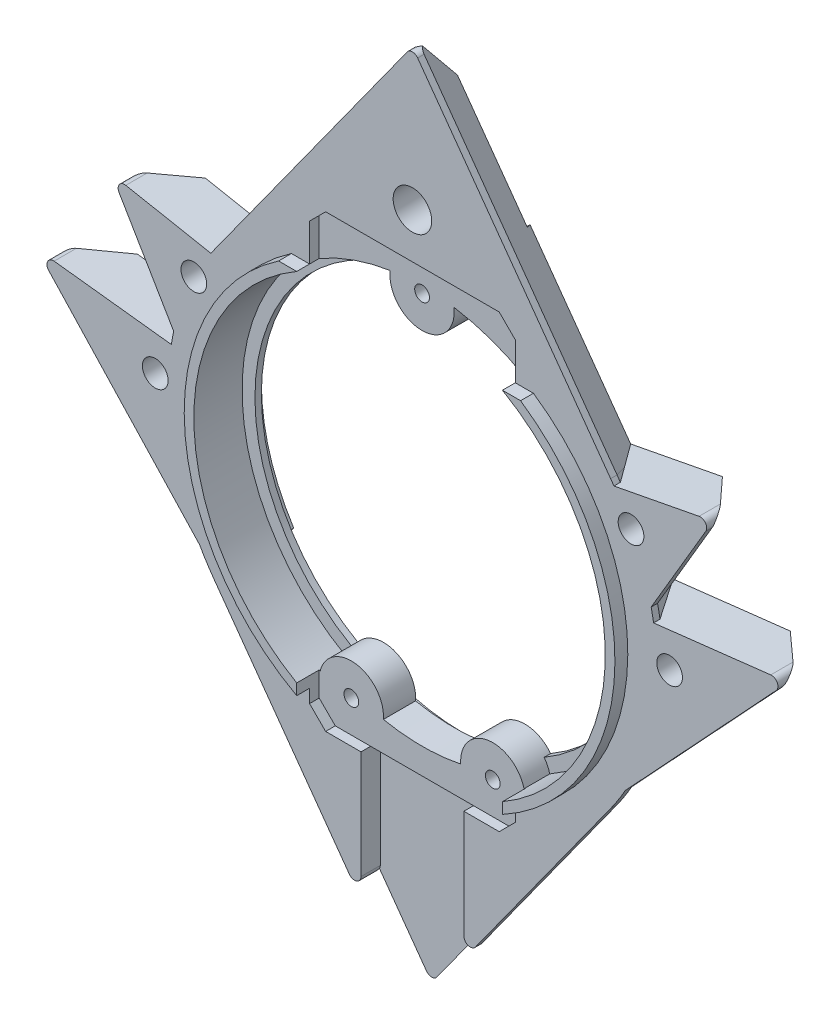
from build123d import *

# Parameters (mm, degrees)
EXTRUDE_1_DEPTH           = 8
CHAMFER_12_SIZE           = 7
CHAMFER_12_SIZE_2         = 5
SKETCH_11_R               = 31.5
CUT_EXTRUDE_1_DEPTH       = 1.5
EXTRUDE_5_DEPTH           = 8
EXTRUDE_5_2_DEPTH         = 8
EXTRUDE_5_3_DEPTH         = 8
EXTRUDE_5_4_DEPTH         = 8
CHAMFER_13_SIZE           = 7
CHAMFER_13_SIZE_2         = 5
CHAMFER_14_SIZE           = 7
CHAMFER_14_SIZE_2         = 5
CHAMFER_15_SIZE           = 7
CHAMFER_15_SIZE_2         = 5
CHAMFER_16_SIZE           = 7
CHAMFER_16_SIZE_2         = 5
SKETCH_23_W               = 32
SKETCH_23_H               = 70
CUT_EXTRUDE_7_DEPTH       = 1.5
SKETCH_13_W               = 16
SKETCH_13_H               = 31
CUT_EXTRUDE_2_DEPTH       = 3
HOLE_WIZARD_M2_25_D       = 2.3
HOLE_WIZARD_M2_25_DEPTH   = 2.5
HOLE_WIZARD_M2_25_TIP     = 0.690989712
CUT_EXTRUDE_START         = -5.5
CUT_EXTRUDE_12_DEPTH      = 5.5
CHAMFER_19_SIZE           = 2.5
CUT_EXTRUDE_9_DEPTH       = 1
SKETCH_15_R               = 35
SKETCH_15_R_2             = 17.5
CUT_EXTRUDE_10_DEPTH      = 1
FILLET_1_R                = 1
CUT_EXTRUDE_13_DEPTH      = 86.964282311
CUT_EXTRUDE_14_DEPTH      = 87.10376201
CUT_EXTRUDE_14_DEPTH_BACK = 87.10376201
SKETCH_37_R               = 3
CHAMFER_20_SIZE           = 2
SKETCH_29_R               = 2
CUT_EXTRUDE_15_DEPTH      = 4.2
EXTRUDE_6_DEPTH           = 2


# Read off the part's stored shape, not the designer's step: Вырез-Вытянуть12
with BuildPart() as part:
    # Эскиз1 → Бобышка-Вытянуть1 (new body)
    with BuildSketch(Plane.XY):
        with BuildLine():
            Line((30.829801919, 22.215384615), (0.811310577, 63.874089069))
            ThreePointArc((0.811310577, 63.874089069), (0, 64.289473684), (-0.811310577, 63.874089069))
            Line((-0.811310577, 63.874089069), (-30.829801919, 22.215384615))
            ThreePointArc((-30.829801919, 22.215384615), (-38, 0), (-30.829801919, -22.215384615))
            Line((-30.829801919, -22.215384615), (-0.811310577, -63.874089069))
            ThreePointArc((-0.811310577, -63.874089069), (0, -64.289473684), (0.811310577, -63.874089069))
            Line((0.811310577, -63.874089069), (30.829801919, -22.215384615))
            ThreePointArc((30.829801919, -22.215384615), (38, 0), (30.829801919, 22.215384615))
        make_face()
        with BuildLine():
            ThreePointArc((4.803744637, 29.612903226), (29.508862916, 5.406201012), (14.989905463, -25.986587583))
            ThreePointArc((14.989905463, -25.986587583), (9.226728829, -24.325012368), (6.015292042, -29.390751294))
            ThreePointArc((6.015292042, -29.390751294), (0, -30), (-6.015292042, -29.390751294))
            ThreePointArc((-6.015292042, -29.390751294), (-9.226728829, -24.325012368), (-14.989905463, -25.986587583))
            ThreePointArc((-14.989905463, -25.986587583), (-29.508862916, 5.406201012), (-4.803744637, 29.612903226))
            ThreePointArc((-4.803744637, 29.612903226), (0, 26), (4.803744637, 29.612903226))
        make_face(mode=Mode.SUBTRACT)
    extrude(amount=EXTRUDE_1_DEPTH)

    # Фаска12
    # the kernel refuses this chamfer: 7, 5 mm, written as the material it takes off along each edge
    with BuildSketch(Plane(origin=(-30.829801919, -22.215384615, 0), x_dir=(-0.018263348031143992, -0.013160230543711323, 0.9997465971188547), z_dir=(0.5846153846153845, -0.8113105768267822, 0)), Plane(origin=(-9.755140998, -78.537873409, 0), x_dir=(0.018263348031144277, -0.013160230543711529, 0.9997465971188547), z_dir=(0.5846153846153846, 0.8113105768267822, 0)), Plane(origin=(9.755140998, 78.537873409, 0), x_dir=(-0.018263348031144155, 0.013160230543711439, 0.9997465971188547), z_dir=(-0.5846153846153846, -0.8113105768267822, 0)), Plane(origin=(30.829801919, 22.215384615, 0), x_dir=(0.018263348031143992, 0.013160230543711323, 0.9997465971188547), z_dir=(-0.5846153846153846, 0.8113105768267822, 0))) as chamfer_12_piece_1:
        Polygon((CHAMFER_12_SIZE * 0.999746597119, -CHAMFER_12_SIZE * 0.0225109206669), (-CHAMFER_12_SIZE_2 * 0.0225109206669, -CHAMFER_12_SIZE_2 * 0.999746597119), (0, 0), align=None)
    extrude(amount=69.421612884, mode=Mode.SUBTRACT)
    with BuildSketch(Plane(origin=(0, 0, 0), x_dir=(0.8113105768267822, -0.5846153846153845, 0), z_dir=(-0.5846153846153845, -0.8113105768267822, 0))) as chamfer_12_piece_2:
        Polygon((38, CHAMFER_12_SIZE), (38 - CHAMFER_12_SIZE_2, 0), (38, 0), align=None)
    revolve(axis=Axis((0, 0, 0), (0, 0, 1)), revolution_arc=71.551646689, mode=Mode.SUBTRACT)
    with BuildSketch(Plane(origin=(0, 0, 0), x_dir=(-0.8113105768267815, 0.5846153846153852, 0), z_dir=(0.5846153846153852, 0.8113105768267815, 0))) as chamfer_12_piece_3:
        Polygon((38, CHAMFER_12_SIZE), (38 - CHAMFER_12_SIZE_2, 0), (38, 0), align=None)
    revolve(axis=Axis((0, 0, 0), (0, 0, 1)), revolution_arc=71.551646689, mode=Mode.SUBTRACT)

    # Эскиз11 → Вырез-Вытянуть1 (cut)
    with BuildSketch(Plane(origin=(0, 0, 0), x_dir=(-1, 0, 0), z_dir=(0, 0, -1))):
        Circle(SKETCH_11_R)
    extrude(amount=-CUT_EXTRUDE_1_DEPTH, mode=Mode.SUBTRACT)


with BuildPart() as body_2:
    # Эскиз17 → Бобышка-Вытянуть5 (new body)
    with BuildSketch(Plane(origin=(0, 0, 8), x_dir=(-1, 0, 0), z_dir=(0, 0, -1))):
        with BuildLine():
            Line((27.658633372, -18), (31.430265195, -20.454545455))
            Line((31.430265195, -20.454545455), (56.580125307, 6.558267258))
            ThreePointArc((56.580125307, 6.558267258), (56.740609868, 7.690973443), (55.733168502, 8.233044002))
            Line((55.733168502, 8.233044002), (32.530722923, 5.545454545))
            ThreePointArc((32.530722923, 5.545454545), (32.315426041, -6.686795927), (27.658633372, -18))
        make_face()
    extrude(amount=EXTRUDE_5_DEPTH)

    # Фаска13
    # the kernel refuses this chamfer: 7, 5 mm, written as the material it takes off along each edge
    with BuildSketch(Plane(origin=(-19.114174879, -33.682938757, 0), x_dir=(-0.016475607194987148, -0.015339358422919067, 0.9997465971188547), z_dir=(-0.6814185279188429, 0.7318939744313498, 0))) as chamfer_13_piece_1:
        Polygon((CHAMFER_13_SIZE * 0.999746597119, CHAMFER_13_SIZE * 0.0225109206669), (-CHAMFER_13_SIZE_2 * 0.0225109206669, CHAMFER_13_SIZE_2 * 0.999746597119), (0, 0), align=None)
    extrude(amount=73.056482477, mode=Mode.SUBTRACT)


with BuildPart() as body_3:
    # Эскиз17 → Extrude 5 2 (new body)
    with BuildSketch(Plane(origin=(0, 0, 8), x_dir=(-1, 0, 0), z_dir=(0, 0, -1))):
        with BuildLine():
            Line((-31.430265195, -20.454545455), (-27.658633372, -18))
            ThreePointArc((-27.658633372, -18), (-32.315426041, -6.686795927), (-32.530722923, 5.545454545))
            Line((-32.530722923, 5.545454545), (-55.733168502, 8.233044002))
            ThreePointArc((-55.733168502, 8.233044002), (-56.740609868, 7.690973443), (-56.580125307, 6.558267258))
            Line((-56.580125307, 6.558267258), (-31.430265195, -20.454545455))
        make_face()
    extrude(amount=EXTRUDE_5_2_DEPTH)

    # Фаска14
    # the kernel refuses this chamfer: 7, 5 mm, written as the material it takes off along each edge
    with BuildSketch(Plane(origin=(68.896215623, 19.786660561, 0), x_dir=(0.016475607194987654, -0.01533935842291954, 0.9997465971188547), z_dir=(-0.6814185279188428, -0.7318939744313497, 0))) as chamfer_14_piece_1:
        Polygon((CHAMFER_14_SIZE * 0.999746597119, CHAMFER_14_SIZE * 0.0225109206669), (-CHAMFER_14_SIZE_2 * 0.0225109206669, CHAMFER_14_SIZE_2 * 0.999746597119), (0, 0), align=None)
    extrude(amount=73.056482477, mode=Mode.SUBTRACT)


with BuildPart() as body_4:
    # Эскиз17 → Extrude 5 3 (new body)
    with BuildSketch(Plane(origin=(0, 0, 8), x_dir=(-1, 0, 0), z_dir=(0, 0, -1))):
        with BuildLine():
            ThreePointArc((25.909216128, 20.438016529), (29.943619234, 13.870099754), (32.34435074, 6.545454545))
            Line((32.34435074, 6.545454545), (36.754944023, 7.438016529))
            Line((36.754944023, 7.438016529), (45.633903711, 22.532247998))
            ThreePointArc((45.633903711, 22.532247998), (45.589131135, 23.615676709), (44.583521637, 24.021351321))
            Line((44.583521637, 24.021351321), (25.909216128, 20.438016529))
        make_face()
    extrude(amount=EXTRUDE_5_3_DEPTH)

    # Фаска16
    # the kernel refuses this chamfer: 7, 5 mm, written as the material it takes off along each edge
    with BuildSketch(Plane(origin=(-27.590964156, -8.140749245, 0), x_dir=(-0.01940293273748138, -0.01141348984557729, 0.9997465971188547), z_dir=(-0.5070201265633941, 0.8619342151577695, 0))) as chamfer_16_piece_1:
        Polygon((CHAMFER_16_SIZE * 0.999746597119, CHAMFER_16_SIZE * 0.0225109206669), (-CHAMFER_16_SIZE_2 * 0.0225109206669, CHAMFER_16_SIZE_2 * 0.999746597119), (0, 0), align=None)
    extrude(amount=53.660432785, mode=Mode.SUBTRACT)


with BuildPart() as body_5:
    # Эскиз17 → Extrude 5 4 (new body)
    with BuildSketch(Plane(origin=(0, 0, 8), x_dir=(-1, 0, 0), z_dir=(0, 0, -1))):
        with BuildLine():
            Line((-36.754944023, 7.438016529), (-32.34435074, 6.545454545))
            ThreePointArc((-32.34435074, 6.545454545), (-29.943619234, 13.870099754), (-25.909216128, 20.438016529))
            Line((-25.909216128, 20.438016529), (-44.583521637, 24.021351321))
            ThreePointArc((-44.583521637, 24.021351321), (-45.589131135, 23.615676709), (-45.633903711, 22.532247998))
            Line((-45.633903711, 22.532247998), (-36.754944023, 7.438016529))
        make_face()
    extrude(amount=EXTRUDE_5_4_DEPTH)

    # Фаска15
    # the kernel refuses this chamfer: 7, 5 mm, written as the material it takes off along each edge
    with BuildSketch(Plane(origin=(54.797883578, 38.111013772, 0), x_dir=(0.01940293273748127, -0.011413489845577225, 0.9997465971188547), z_dir=(-0.5070201265633941, -0.8619342151577695, 0))) as chamfer_15_piece_1:
        Polygon((CHAMFER_15_SIZE * 0.999746597119, CHAMFER_15_SIZE * 0.0225109206669), (-CHAMFER_15_SIZE_2 * 0.0225109206669, CHAMFER_15_SIZE_2 * 0.999746597119), (0, 0), align=None)
    extrude(amount=53.660432785, mode=Mode.SUBTRACT)


with BuildPart() as body_2_1:
    add(body_2.part)

    # Combine 2: union body 3, body 5, body 4, part
    add(body_3.part)
    add(body_5.part)
    add(body_4.part)
    add(part.part)

    # Эскиз23 → Вырез-Вытянуть7 (cut)
    with BuildSketch(Plane.XY.offset(8)):
        with Locations((0, 1)):
            Rectangle(SKETCH_23_W, SKETCH_23_H)
    extrude(amount=-CUT_EXTRUDE_7_DEPTH, mode=Mode.SUBTRACT)

    # Эскиз13 → Вырез-Вытянуть2 (cut)
    with BuildSketch(Plane.XY.offset(8)):
        with Locations((0, -49.5)):
            Rectangle(SKETCH_13_W, SKETCH_13_H)
    extrude(amount=-CUT_EXTRUDE_2_DEPTH, mode=Mode.SUBTRACT)

    # Hole Wizard M2.25
    with Locations(Plane.XY.offset(6.5)):
        with Locations((0, 31), (-11, -29), (11, -29)):
            Hole(HOLE_WIZARD_M2_25_D / 2, depth=HOLE_WIZARD_M2_25_DEPTH)
            with Locations((0, 0, -(HOLE_WIZARD_M2_25_DEPTH + HOLE_WIZARD_M2_25_TIP / 2))):  # 118° drill point
                Cone(0, HOLE_WIZARD_M2_25_D / 2, HOLE_WIZARD_M2_25_TIP, mode=Mode.SUBTRACT)

    # Вырез-Вытянуть12 outline → Вырез-Вытянуть12 (cut)
    with BuildSketch(Plane.XY.offset(8).offset(CUT_EXTRUDE_START)):
        with BuildLine():
            ThreePointArc((14.989905463, -25.986587583), (15.513241495, -26.848105205), (15.853142564, -27.797083855))
            ThreePointArc((15.853142564, -27.797083855), (31.475502035, 5.769988875), (4.96229278, 31.612903226))
            ThreePointArc((4.96229278, 31.612903226), (4.984362718, 30.604869274), (4.803744637, 29.612903226))
            ThreePointArc((4.803744637, 29.612903226), (29.508862916, 5.406201012), (14.989905463, -25.986587583))
        make_face()
        with BuildLine():
            ThreePointArc((-4.803744637, 29.612903226), (-4.984362718, 30.604869274), (-4.96229278, 31.612903226))
            ThreePointArc((-4.96229278, 31.612903226), (-31.475502035, 5.769988875), (-15.853142564, -27.797083855))
            ThreePointArc((-15.853142564, -27.797083855), (-15.513241495, -26.848105205), (-14.989905463, -25.986587583))
            ThreePointArc((-14.989905463, -25.986587583), (-29.508862916, 5.406201012), (-4.803744637, 29.612903226))
        make_face()
    extrude(amount=CUT_EXTRUDE_12_DEPTH, mode=Mode.SUBTRACT)

    # Фаска19
    chamfer_19_edges = [body_2_1.edges().sort_by_distance(p)[0] for p in [
        (-16, -34, 7.25),
        (16, -34, 7.25),
        (-16, 36, 7.25),
        (16, 36, 7.25),
    ]]
    chamfer(chamfer_19_edges, length=CHAMFER_19_SIZE)

    # Эскиз18 → Вырез-Вытянуть9 (cut)
    with BuildSketch(Plane(origin=(0, 0, 0), x_dir=(-1, 0, 0), z_dir=(0, 0, -1))):
        with BuildLine():
            Line((-14.395430735, 45.022480556), (0, 60))
            Line((0, 60), (14.395430735, 45.022480556))
            ThreePointArc((14.395430735, 45.022480556), (7.024876919, 39.121099102), (1.5, 31.464265445))
            ThreePointArc((1.5, 31.464265445), (0, 31.5), (-1.5, 31.464265445))
            ThreePointArc((-1.5, 31.464265445), (-7.024876919, 39.121099102), (-14.395430735, 45.022480556))
        make_face()
    extrude(amount=-CUT_EXTRUDE_9_DEPTH, mode=Mode.SUBTRACT)

    # Эскиз15 → Вырез-Вытянуть10 (cut)
    with BuildSketch(Plane(origin=(0, 0, 0), x_dir=(-1, 0, 0), z_dir=(0, 0, -1))):
        with Locations((0, -40)):
            Circle(SKETCH_15_R)
        with Locations((0, -40)):
            Circle(SKETCH_15_R_2, mode=Mode.SUBTRACT)
    extrude(amount=-CUT_EXTRUDE_10_DEPTH, mode=Mode.SUBTRACT)

    # Скругление1
    fillet_1_edges = [body_2_1.edges().sort_by_distance(p)[0] for p in [
        (8, -53.897855264, 7.5),
        (-8, -53.897855264, 7.5),
    ]]
    fillet(fillet_1_edges, radius=FILLET_1_R)

    # Эскиз36 → Вырез-Вытянуть13 (cut, through all)
    with BuildSketch(Plane.XY.offset(5)):
        with BuildLine():
            Line((-0.811310577, -61.430480046), (0, -62.556390977))
            Line((0, -62.556390977), (0.811310577, -61.430480046))
            ThreePointArc((0.811310577, -61.430480046), (0, -61.845864662), (-0.811310577, -61.430480046))
        make_face()
    extrude(amount=-CUT_EXTRUDE_13_DEPTH, mode=Mode.SUBTRACT)

    # Эскиз37 → Вырез-Вытянуть14 (cut, two sides: drawn at the far end of the back side and taken through both)
    with BuildSketch(Plane(origin=(0, 0, 1), x_dir=(-1, 0, 0), z_dir=(0, 0, -1)).offset(-CUT_EXTRUDE_14_DEPTH_BACK)):
        with Locations((0, 43)):
            Circle(SKETCH_37_R)
    extrude(amount=CUT_EXTRUDE_14_DEPTH + CUT_EXTRUDE_14_DEPTH_BACK, mode=Mode.SUBTRACT)

    # Фаска20
    chamfer_20_edges = [body_2_1.edges().sort_by_distance(p)[0] for p in [
        (3, 43, 1),
    ]]
    chamfer(chamfer_20_edges, length=CHAMFER_20_SIZE)

    # Эскиз29 → Вырез-Вытянуть15 (cut)
    with BuildSketch(Plane.XY.offset(8)):
        with Locations((-34, 17)):
            Circle(SKETCH_29_R)
        with Locations((-40, 1)):
            Circle(SKETCH_29_R)
        with Locations((34, 17)):
            Circle(SKETCH_29_R)
        with Locations((40, 1)):
            Circle(SKETCH_29_R)
    extrude(amount=-CUT_EXTRUDE_15_DEPTH, mode=Mode.SUBTRACT)

    # Эскиз38 → Бобышка-Вытянуть6 (add)
    with BuildSketch(Plane.XY.offset(8)):
        with BuildLine():
            ThreePointArc((-16, -27.712812921), (-32, 0), (-16, 27.712812921))
            Line((-16, 27.712812921), (-18.821530225, 27.712812921))
            ThreePointArc((-18.821530225, 27.712812921), (-33.459239875, -1.652049325), (-16, -29.432125306))
            Line((-16, -29.432125306), (-16, -27.712812921))
        make_face()
        with BuildLine():
            Line((18.821530225, 27.712812921), (16, 27.712812921))
            ThreePointArc((16, 27.712812921), (27.712812921, 16), (32, 0))
            ThreePointArc((32, 0), (27.712812921, -16), (16, -27.712812921))
            Line((16, -27.712812921), (16, -29.432125306))
            ThreePointArc((16, -29.432125306), (28.794530731, -17.120893668), (33.5, 0))
            ThreePointArc((33.5, 0), (29.603811094, 15.680062778), (18.821530225, 27.712812921))
        make_face()
    extrude(amount=EXTRUDE_6_DEPTH)


solid = body_2_1.part
